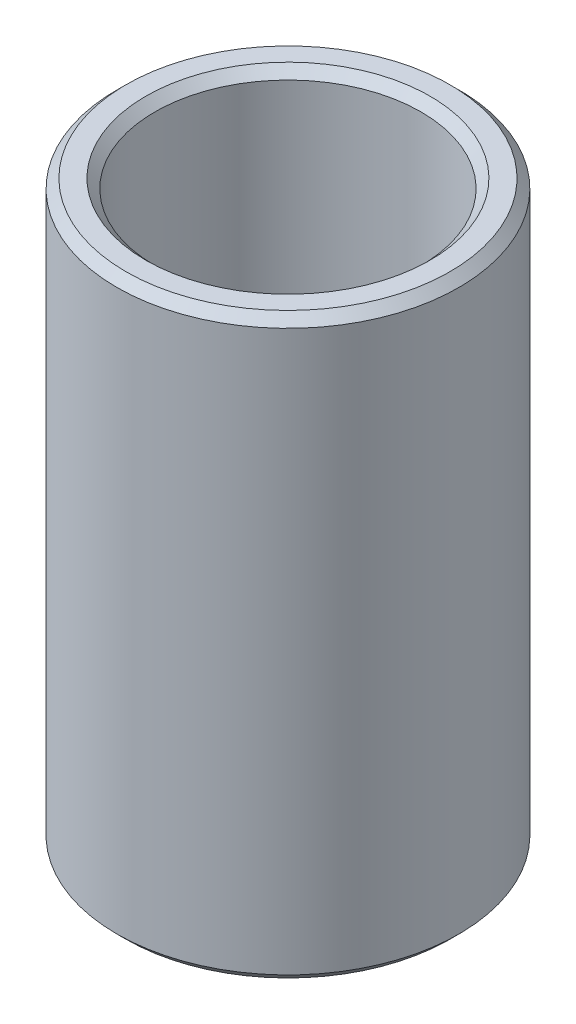
from build123d import *

# Parameters (mm, degrees)
SKETCH1_R           = 55
BOSS_EXTRUDE1_DEPTH = 185.866558243
SKETCH2_R           = 42.779928752
CUT_EXTRUDE1_DEPTH  = 202.485427446
CHAMFER1_SIZE       = 2.917590461


with BuildPart() as part:
    # Sketch1 → Boss-Extrude1 (new body)
    with BuildSketch(Plane(origin=(0, 0, 0), x_dir=(1, 0, 0), z_dir=(0, 1, 0))):
        Circle(SKETCH1_R)
    extrude(amount=BOSS_EXTRUDE1_DEPTH)

    # Sketch2 → Cut-Extrude1 (cut, through all)
    with BuildSketch(Plane(origin=(0, 0, 0), x_dir=(1, 0, 0), z_dir=(0, 1, 0))):
        Circle(SKETCH2_R)
    extrude(amount=CUT_EXTRUDE1_DEPTH, mode=Mode.SUBTRACT)

    # Chamfer1
    chamfer1_edges = [part.edges().sort_by_distance(p)[0] for p in [
        (-42.779928752, 185.866558243, 0),
        (-42.779928752, 0, 0),
        (-55, 0, 0),
        (-55, 185.866558243, 0),
    ]]
    chamfer(chamfer1_edges, length=CHAMFER1_SIZE)


solid = part.part
